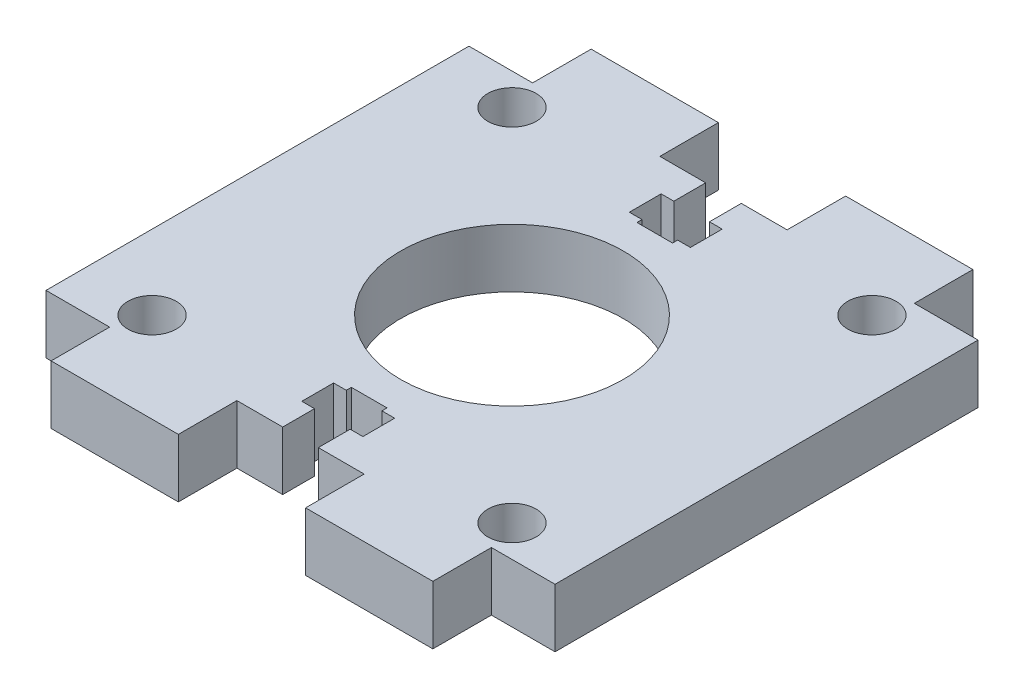
from build123d import *

# Parameters (mm, degrees)
SKETCH1_R           = 2.413
SKETCH1_R_2         = 11.1125
BOSS_EXTRUDE1_DEPTH = 5.842


with BuildPart() as part:
    # Sketch1 → Boss-Extrude1 (new body)
    with BuildSketch(Plane(origin=(0, 0, 0), x_dir=(1, 0, 0), z_dir=(0, 1, 0))):
        Polygon((19.05, -21.1058), (25.4, -21.1058), (25.4, 21.1058), (19.05, 21.1058), (19.05, 26.9478), (6.35, 26.9478), (6.35, 21.1058), (1.778, 21.1058), (1.778, 17.9308), (3.048, 17.9308), (3.048, 14.7558), (1.778, 14.7558), (1.778, 14.2478), (-1.778, 14.2478), (-1.778, 14.7558), (-3.048, 14.7558), (-3.048, 17.9308), (-1.778, 17.9308), (-1.778, 21.1058), (-6.35, 21.1058), (-6.35, 26.9478), (-19.05, 26.9478), (-19.05, 21.1058), (-25.4, 21.1058), (-25.4, -21.1058), (-19.05, -21.1058), (-19.05, -26.9478), (-6.35, -26.9478), (-6.35, -21.1058), (-1.778, -21.1058), (-1.778, -17.9308), (-3.048, -17.9308), (-3.048, -14.7558), (-1.778, -14.7558), (-1.778, -14.2478), (1.778, -14.2478), (1.778, -14.7558), (3.048, -14.7558), (3.048, -17.9308), (1.778, -17.9308), (1.778, -21.1058), (6.35, -21.1058), (6.35, -26.9478), (19.05, -26.9478), align=None)
        with Locations((-17.960512242, -17.960512242)):
            Circle(SKETCH1_R, mode=Mode.SUBTRACT)
        with Locations((17.960512242, -17.960512242)):
            Circle(SKETCH1_R, mode=Mode.SUBTRACT)
        Circle(SKETCH1_R_2, mode=Mode.SUBTRACT)
        with Locations((-17.960512242, 17.960512242)):
            Circle(SKETCH1_R, mode=Mode.SUBTRACT)
        with Locations((17.960512242, 17.960512242)):
            Circle(SKETCH1_R, mode=Mode.SUBTRACT)
    extrude(amount=BOSS_EXTRUDE1_DEPTH)


solid = part.part
